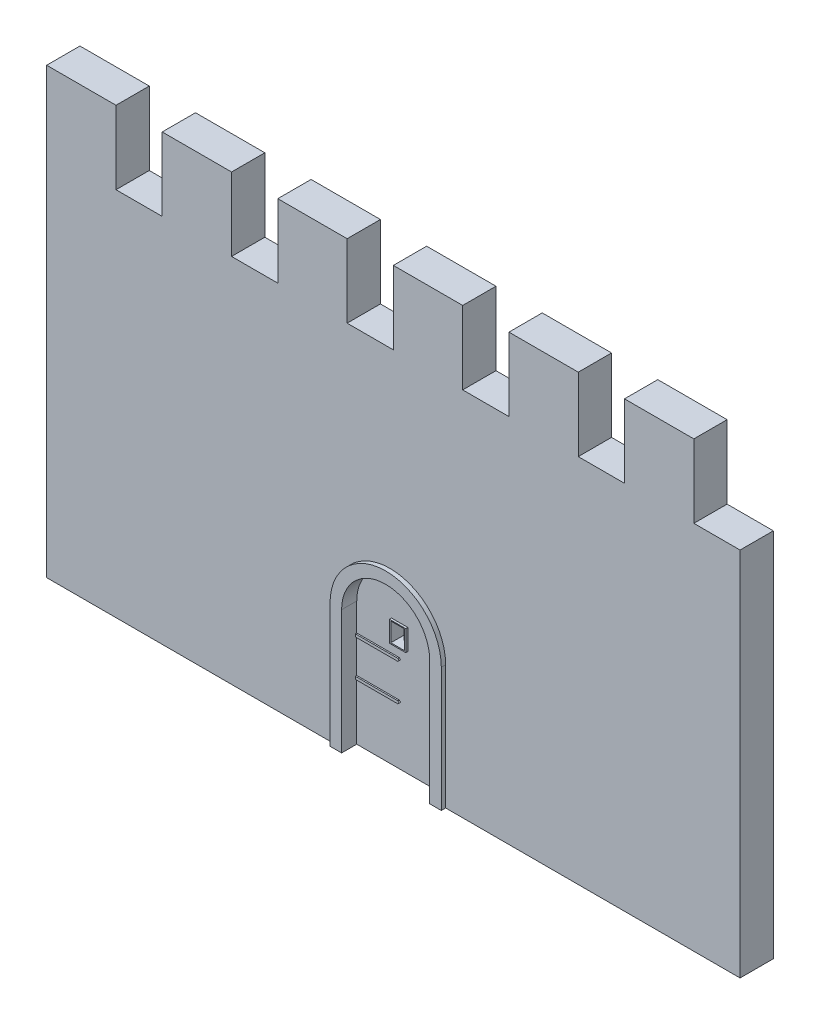
from build123d import *
from build123d.topology import SkipClean

# Parameters (mm, degrees)
SKETCH1_W                = 38100
SKETCH1_H                = 24384
BOSS_EXTRUDE1_DEPTH      = 1828.8
SKETCH2_W                = 2540
SKETCH2_H                = 4019.249447419
CUT_EXTRUDE2_DEPTH       = 1828.8
CUT_EXTRUDE7_DEPTH       = 283.464
CUT_EXTRUDE9_START       = -593.09
CUT_EXTRUDE9_DEPTH       = 593.09
SKETCH5_W                = 748.392768262
SKETCH5_H                = 1034.235711045
CUT_EXTRUDE10_DEPTH      = 2197.608
BOSS_EXTRUDE2_DEPTH      = 127
BOSS_EXTRUDE2_DEPTH_BACK = 1066.8
SKETCH8_W                = 900.792768262
SKETCH8_H                = 1143
SKETCH8_W_2              = 748.392768262
SKETCH8_H_2              = 1034.235711045
SKETCH9_R                = 25.4
BOSS_EXTRUDE3_DEPTH      = 1070.61
BOSS_EXTRUDE4_DEPTH      = 76.2
BOSS_EXTRUDE4_DEPTH_BACK = 1016
BOSS_EXTRUDE5_DEPTH      = 238.76
BOSS_EXTRUDE5_DEPTH_BACK = 2032


with BuildPart() as part:
    # Sketch1 → Boss-Extrude1 (new body)
    with BuildSketch(Plane.XY):
        with Locations((19050, 12192)):
            Rectangle(SKETCH1_W, SKETCH1_H)
    extrude(amount=BOSS_EXTRUDE1_DEPTH)

    # Sketch2 → Cut-Extrude2 (cut)
    with BuildSketch(Plane.XY.offset(1828.8)):
        with Locations((5080, 22374.37527629)):
            Rectangle(SKETCH2_W, SKETCH2_H)
        with Locations((11430, 22374.37527629)):
            Rectangle(SKETCH2_W, SKETCH2_H)
        with Locations((17780, 22374.37527629)):
            Rectangle(SKETCH2_W, SKETCH2_H)
        with Locations((24130, 22374.37527629)):
            Rectangle(SKETCH2_W, SKETCH2_H)
        with Locations((30480, 22374.37527629)):
            Rectangle(SKETCH2_W, SKETCH2_H)
        with Locations((36830, 22374.37527629)):
            Rectangle(SKETCH2_W, SKETCH2_H)
    extrude(amount=-CUT_EXTRUDE2_DEPTH, mode=Mode.SUBTRACT)

    # Sketch3 → Cut-Extrude7 (cut)
    with BuildSketch(Plane(origin=(0, 0, 0), x_dir=(-1, 0, 0), z_dir=(0, 0, -1))):
        with BuildLine():
            Line((-16444.950240223, 0), (-21288.141342907, 0))
            Line((-21288.141342907, 0), (-21288.141342907, 6816.791692855))
            ThreePointArc((-21288.141342907, 6816.791692855), (-18866.545791565, 9238.387244197), (-16444.950240223, 6816.791692855))
            Line((-16444.950240223, 6816.791692855), (-16444.950240223, 0))
        make_face()
    extrude(amount=-CUT_EXTRUDE7_DEPTH, mode=Mode.SUBTRACT)

    # Sketch6 → Cut-Extrude9 (cut)
    with BuildSketch(Plane.XY.offset(1828.8).offset(CUT_EXTRUDE9_START)):
        with BuildLine():
            Line((16444.950240223, 0), (21288.141342907, 0))
            Line((21288.141342907, 0), (21288.141342907, 6816.791692855))
            ThreePointArc((21288.141342907, 6816.791692855), (20578.87242721, 8529.1183285), (18866.545791565, 9238.387244197))
            ThreePointArc((18866.545791565, 9238.387244197), (17154.21915592, 8529.1183285), (16444.950240223, 6816.791692855))
            Line((16444.950240223, 6816.791692855), (16444.950240223, 0))
        make_face()
    extrude(amount=CUT_EXTRUDE9_DEPTH, mode=Mode.SUBTRACT)

    # Sketch5 → Cut-Extrude10 (cut)
    with BuildSketch(Plane(origin=(0, 0, 283.464), x_dir=(-1, 0, 0), z_dir=(0, 0, -1))):
        with Locations((-18808.252380156, 6397.263349082)):
            Rectangle(SKETCH5_W, SKETCH5_H)
    extrude(amount=-CUT_EXTRUDE10_DEPTH, mode=Mode.SUBTRACT)

    # Sketch8 → Boss-Extrude2 (add, two sides: drawn at the far end of the back side and taken through both)
    with BuildSketch(Plane(origin=(0, 0, 283.464), x_dir=(-1, 0, 0), z_dir=(0, 0, -1)).offset(-BOSS_EXTRUDE2_DEPTH_BACK)):
        with Locations((-18808.252380156, 6389.266447281)):
            Rectangle(SKETCH8_W, SKETCH8_H)
        with Locations((-18808.252380156, 6397.263349082)):
            Rectangle(SKETCH8_W_2, SKETCH8_H_2, mode=Mode.SUBTRACT)
    extrude(amount=BOSS_EXTRUDE2_DEPTH + BOSS_EXTRUDE2_DEPTH_BACK)

    # Sketch9 → Boss-Extrude3 (add)
    with BuildSketch(Plane(origin=(0, 5880.145493559, 0), x_dir=(1, 0, 0), z_dir=(0, 1, 0))):
        with Locations((18852.248764287, -842.264)):
            Circle(SKETCH9_R)
        with Locations((19030.048764287, -842.264096753)):
            Circle(SKETCH9_R)
        with Locations((18674.448764287, -842.264)):
            Circle(SKETCH9_R)
    extrude(amount=BOSS_EXTRUDE3_DEPTH)

    # Sketch10 → Boss-Extrude4 (add, two sides: drawn at the far end of the back side and taken through both)
    with BuildSketch(Plane.XY.offset(1235.71).offset(-BOSS_EXTRUDE4_DEPTH_BACK)):
        Polygon((16444.950240223, 5292.167188251), (18780.763172563, 5292.167188251), (18853.635500849, 5219.294859965), (18780.763172563, 5146.422531679), (16444.950240223, 5146.422531679), align=None)
        Polygon((16444.950240223, 3271.804815759), (18780.763172563, 3271.804815759), (18853.635500849, 3198.932487473), (18780.763172563, 3126.060159187), (16444.950240223, 3126.060159187), align=None)
    extrude(amount=BOSS_EXTRUDE4_DEPTH + BOSS_EXTRUDE4_DEPTH_BACK)

    # Sketch11 → Boss-Extrude5 (add, two sides: drawn at the far end of the back side and taken through both)
    with SkipClean():  # the faces are left unmerged after this step: merging them gives an invalid solid
        with BuildSketch(Plane.XY.offset(1828.8).offset(-BOSS_EXTRUDE5_DEPTH_BACK)):
            with BuildLine():
                Line((15809.950240223, 0), (16444.950240223, 0))
                Line((16444.950240223, 0), (16444.950240223, 6816.791692855))
                ThreePointArc((16444.950240223, 6816.791692855), (18866.545791565, 9238.387244197), (21288.141342907, 6816.791692855))
                Line((21288.141342907, 6816.791692855), (21288.141342907, 0))
                Line((21288.141342907, 0), (21923.141342907, 0))
                Line((21923.141342907, 0), (21923.141342907, 6816.791692855))
                ThreePointArc((21923.141342907, 6816.791692855), (18866.545791565, 9873.387244197), (15809.950240223, 6816.791692855))
                Line((15809.950240223, 6816.791692855), (15809.950240223, 0))
            make_face()
        extrude(amount=BOSS_EXTRUDE5_DEPTH + BOSS_EXTRUDE5_DEPTH_BACK)
    add(part.part.scale(1), mode=Mode.REPLACE)  # the faces are merged on a copy


solid = part.part
